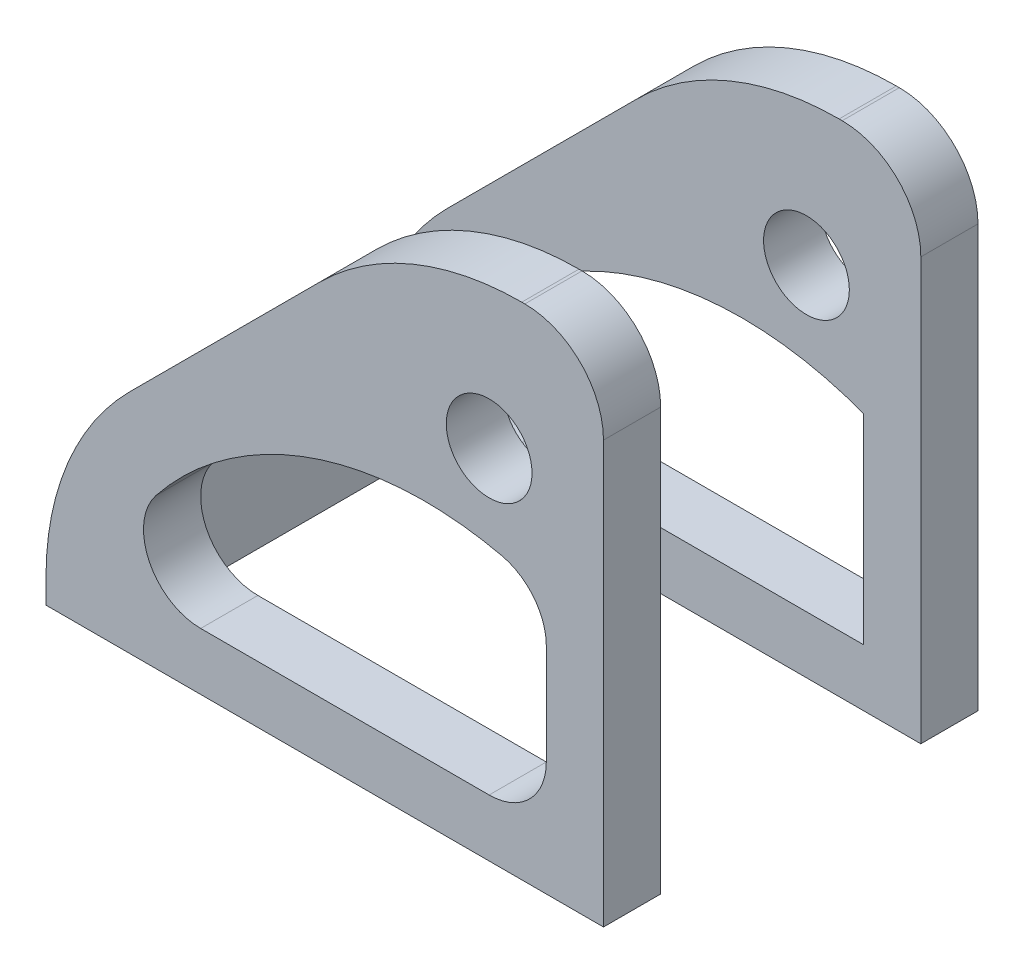
from build123d import *

# Parameters (mm, degrees)
BOSS_EXTRUDE1_DEPTH     = 35
CUT_EXTRUDE1_DEPTH      = 55.01490535
CUT_EXTRUDE1_DEPTH_BACK = 55.01490535
SKETCH4_R               = 3
CHAMFER1_SIZE           = 25
FILLET1_R               = 20
FILLET2_R               = 5.5
FILLET3_R               = 1
CUT_EXTRUDE2_DEPTH      = 59.587029281
CUT_EXTRUDE2_DEPTH_BACK = 59.587029281
FILLET4_R               = 4


with BuildPart() as part:
    # Sketch3 → Boss-Extrude1 (new body)
    with BuildSketch(Plane(origin=(0, 0, 0), x_dir=(1, 0, 0), z_dir=(0, 1, 0))):
        Polygon((39, -13.1), (39, -9.1), (4, -9.1), (4, 9.1), (39, 9.1), (39, 13.1), (0, 13.1), (0, -13.1), align=None)
    extrude(amount=BOSS_EXTRUDE1_DEPTH)

    # Sketch4 → Cut-Extrude1 (cut, two sides: drawn at the far end of the back side and taken through both)
    with BuildSketch(Plane.XY.offset(-CUT_EXTRUDE1_DEPTH_BACK)):
        with Locations((31, 25)):
            Circle(SKETCH4_R)
    extrude(amount=CUT_EXTRUDE1_DEPTH + CUT_EXTRUDE1_DEPTH_BACK, mode=Mode.SUBTRACT)

    # Chamfer1
    # the kernel refuses this chamfer: 25 mm, written as the material it takes off along each edge
    with BuildSketch(Plane(origin=(0, 35, -77.392074699), x_dir=(0.9996219169112966, 0.027495876610586317, 0), z_dir=(0, 0, 1))) as chamfer1_piece_1:
        Polygon((CHAMFER1_SIZE * 0.999621916911, -CHAMFER1_SIZE * 0.0274958766106), (-CHAMFER1_SIZE * 0.0274958766106, -CHAMFER1_SIZE * 0.999621916911), (0, 0), align=None)
    extrude(amount=154.784149398, mode=Mode.SUBTRACT)

    # Fillet1
    # the kernel refuses this fillet: 20 mm, written as the material it takes off along each edge
    with BuildSketch(Plane(origin=(0, 10, -33.810678119), x_dir=(0.7071067811862652, 0.7071067811868299, 0), z_dir=(0, 0, 1))) as fillet1_piece_1:
        with BuildLine():
            CenterArc((FILLET1_R * 0.414213562373, -FILLET1_R), FILLET1_R, 90, 45)
            Line((-FILLET1_R * 0.292893218813, -FILLET1_R * 0.292893218813), (0, 0))
            Line((0, 0), (FILLET1_R * 0.414213562373, 0))
        make_face()
    extrude(amount=67.621356237, mode=Mode.SUBTRACT)
    with BuildSketch(Plane(origin=(25, 35, -33.810678119), x_dir=(-0.7071067811862648, -0.7071067811868303, 0), z_dir=(0, 0, 1))) as fillet1_piece_2:
        with BuildLine():
            CenterArc((FILLET1_R * 0.414213562373, FILLET1_R), FILLET1_R, 225, 45)
            Line((-FILLET1_R * 0.292893218814, FILLET1_R * 0.292893218814), (0, 0))
            Line((0, 0), (FILLET1_R * 0.414213562373, 0))
        make_face()
    extrude(amount=45.421356237, mode=Mode.SUBTRACT)
    with BuildSketch(Plane(origin=(25, 35, -11.610678119), x_dir=(1, 0, 0), z_dir=(0, 0, 1))) as fillet1_piece_3:
        with BuildLine():
            CenterArc((FILLET1_R * 0.414213562373, -FILLET1_R), FILLET1_R, 90, 45)
            Line((-FILLET1_R * 0.292893218814, -FILLET1_R * 0.292893218814), (0, 0))
            Line((0, 0), (FILLET1_R * 0.414213562373, 0))
        make_face()
    extrude(amount=45.421356237, mode=Mode.SUBTRACT)

    # Fillet2
    fillet2_edges = [part.edges().sort_by_distance(p)[0] for p in [
        (39, 35, -11.1),
        (39, 35, 11.1),
    ]]
    fillet(fillet2_edges, radius=FILLET2_R)

    # Fillet3
    fillet3_edges = [part.edges().sort_by_distance(p)[0] for p in [
        (4, 13.715728753, 0),
    ]]
    fillet(fillet3_edges, radius=FILLET3_R)

    # Sketch5 → Cut-Extrude2 (cut, two sides: drawn at the far end of the back side and taken through both)
    with BuildSketch(Plane.XY.offset(13.1).offset(-CUT_EXTRUDE2_DEPTH_BACK)):
        with BuildLine():
            Line((4, 4), (35, 4))
            Line((35, 4), (35, 18))
            ThreePointArc((35, 18), (16.600505063, 17.420310217), (4, 4))
        make_face()
    extrude(amount=CUT_EXTRUDE2_DEPTH + CUT_EXTRUDE2_DEPTH_BACK, mode=Mode.SUBTRACT)

    # Fillet4
    fillet4_edges = [part.edges().sort_by_distance(p)[0] for p in [
        (4, 4, 11.1),
        (4, 4, -11.1),
        (35, 18, 11.1),
        (35, 4, 11.1),
    ]]
    fillet(fillet4_edges, radius=FILLET4_R)


solid = part.part
